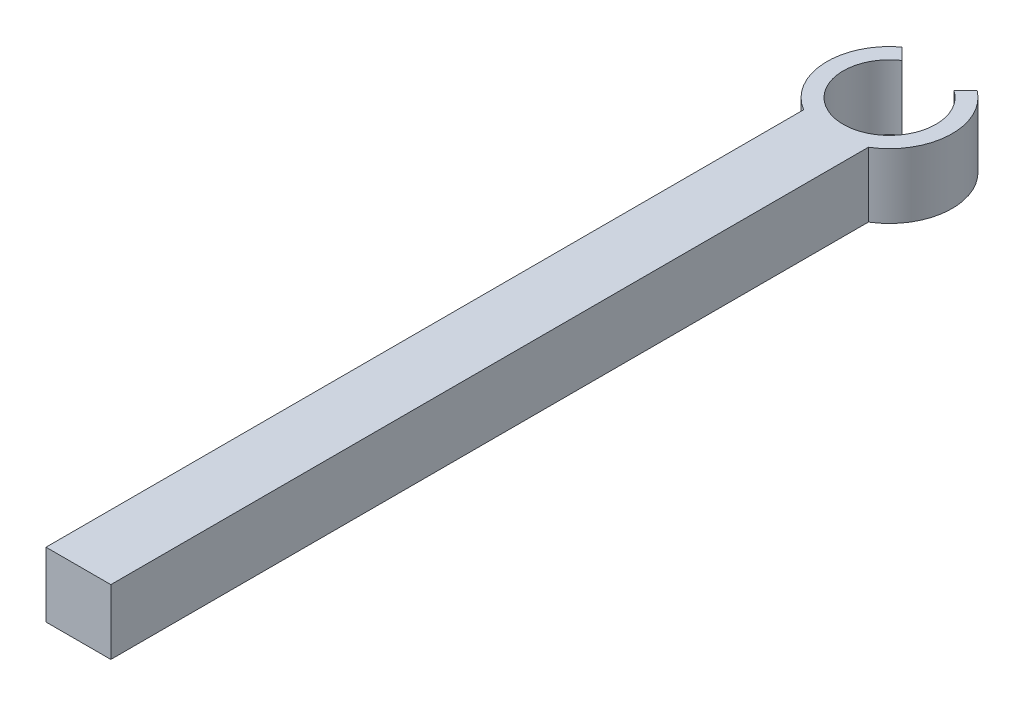
from build123d import *

# Parameters (mm, degrees)
SCHIZZO1_R                   = 7.15
ESTRUSIONE_ESTRUSIONE1_DEPTH = 10
TAGLIO_ESTRUSIONE1_DEPTH     = 85.287841486


with BuildPart() as part:
    # Schizzo1 → Estrusione-Estrusione1 (new body)
    with BuildSketch(Plane(origin=(0, 0, 0), x_dir=(1, 0, 0), z_dir=(0, 1, 0))):
        with BuildLine():
            Line((-10.296487194, 34.510294915), (-10.296487194, -82.347087033))
            Line((-10.296487194, -82.347087033), (-0.296487194, -82.347087033))
            Line((-0.296487194, -82.347087033), (-0.296487194, 34.510294915))
            ThreePointArc((-0.296487194, 34.510294915), (-5.296487194, 52.413930478), (-10.296487194, 34.510294915))
        make_face()
        with Locations((-5.296487194, 42.763930478)):
            Circle(SCHIZZO1_R, mode=Mode.SUBTRACT)
    extrude(amount=ESTRUSIONE_ESTRUSIONE1_DEPTH)

    # Schizzo2 → Taglio-Estrusione1 (cut, through all)
    with BuildSketch(Plane(origin=(0, 10, 0), x_dir=(1, 0, 0), z_dir=(0, 1, 0))):
        Polygon((-16.367555006, 55.761422169), (5.774580618, 55.761422169), (-1.296487194, 48.690354357), (-9.296487194, 48.690354357), align=None)
    extrude(amount=-TAGLIO_ESTRUSIONE1_DEPTH, mode=Mode.SUBTRACT)


solid = part.part
